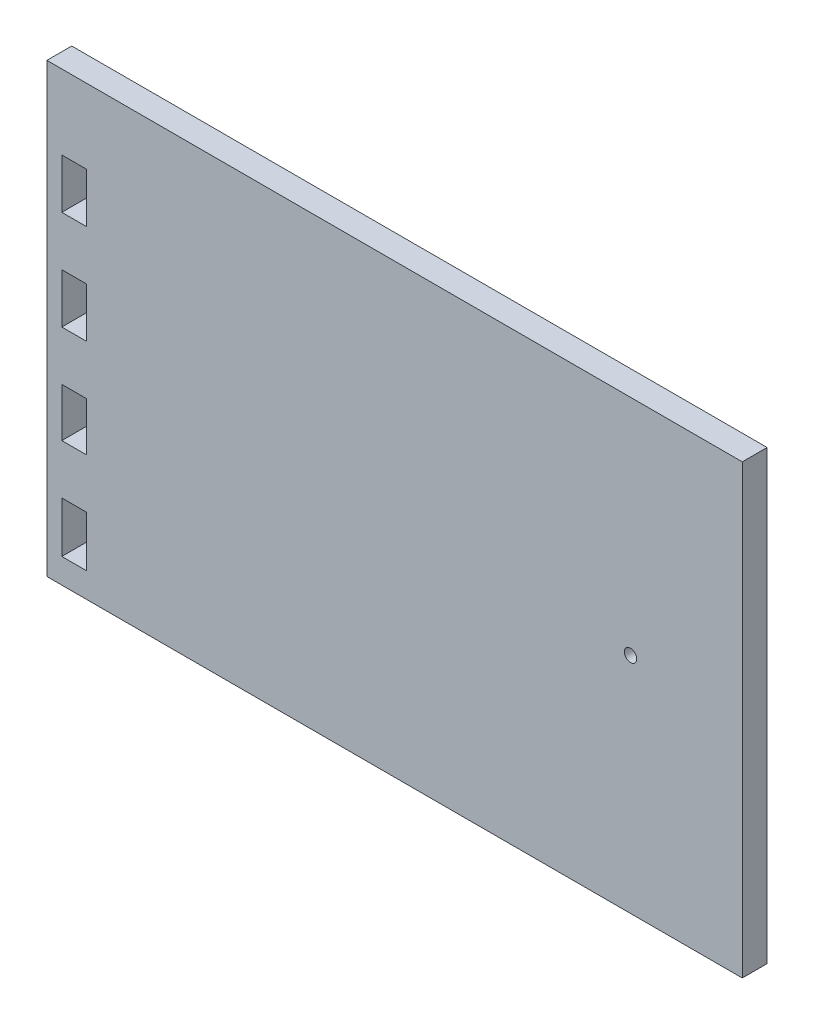
from build123d import *

# Parameters (mm, degrees)
SKETCH2_W           = 355.6
SKETCH2_H           = 228.6
BOSS_EXTRUDE1_DEPTH = 12.7
SKETCH3_R           = 3.175
CUT_EXTRUDE1_DEPTH  = 12.7
SKETCH4_W           = 12.7
SKETCH4_H           = 25.4
SKETCH4_H_2         = 24.892
SKETCH4_H_3         = 25.908
CUT_EXTRUDE2_DEPTH  = 423.930975456


with BuildPart() as part:
    # Sketch2 → Boss-Extrude1 (new body)
    with BuildSketch(Plane.XY):
        with Locations((177.8, -114.3)):
            Rectangle(SKETCH2_W, SKETCH2_H)
    extrude(amount=BOSS_EXTRUDE1_DEPTH)

    # Sketch3 → Cut-Extrude1 (cut)
    with BuildSketch(Plane.XY.offset(12.7)):
        with Locations((298.45, -114.3)):
            Circle(SKETCH3_R)
    extrude(amount=-CUT_EXTRUDE1_DEPTH, mode=Mode.SUBTRACT)

    # Sketch4 → Cut-Extrude2 (cut, through all)
    with BuildSketch(Plane.XY.offset(12.7)):
        with Locations((13.97, -50.8)):
            Rectangle(SKETCH4_W, SKETCH4_H)
        with Locations((13.97, -101.6)):
            Rectangle(SKETCH4_W, SKETCH4_H)
        with Locations((13.97, -152.146)):
            Rectangle(SKETCH4_W, SKETCH4_H_2)
        with Locations((13.97, -202.946)):
            Rectangle(SKETCH4_W, SKETCH4_H_3)
    extrude(amount=-CUT_EXTRUDE2_DEPTH, mode=Mode.SUBTRACT)


solid = part.part
